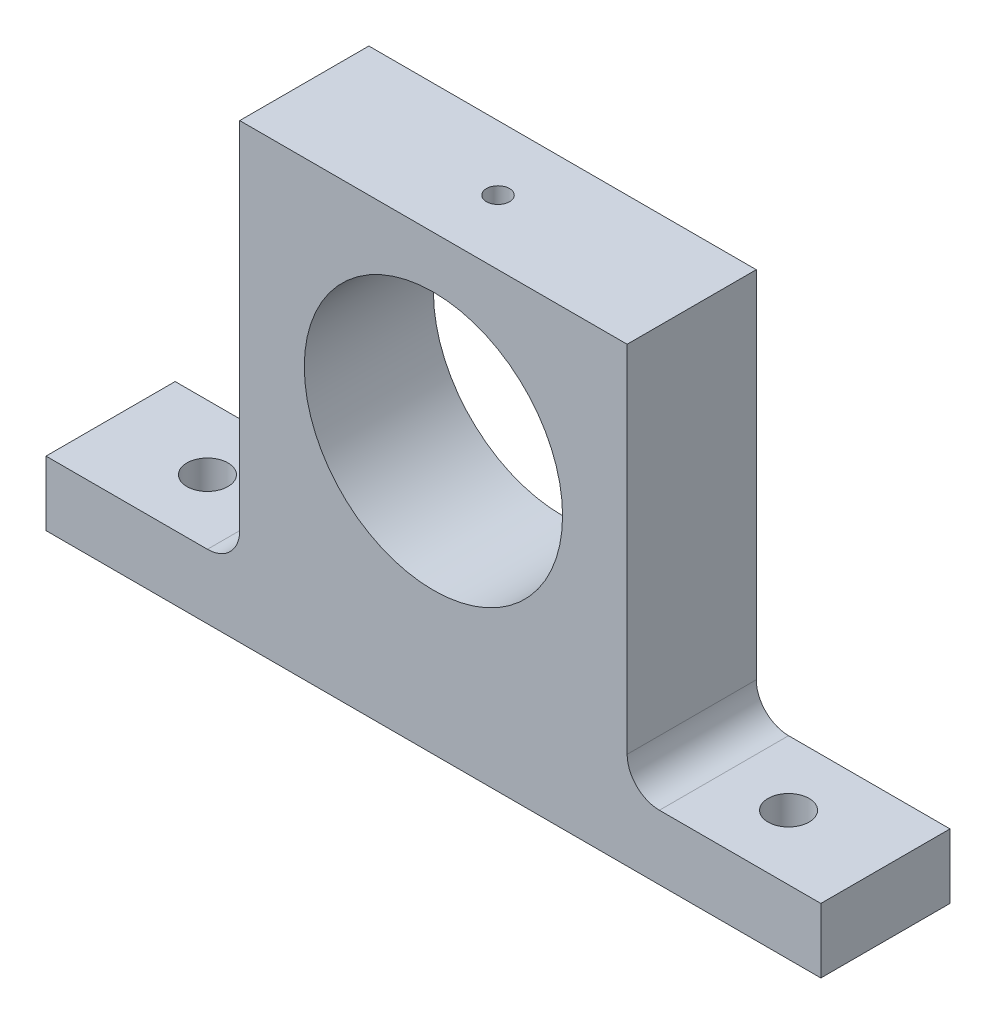
from build123d import *

# Parameters (mm, degrees)
SKETCH1_R                 = 12.7
BOSS_EXTRUDE1_DEPTH       = 12.7
F_10_32_TAPPED_HOLE1_D    = 4.0386
F_4_40_TAPPED_HOLE1_D     = 2.2606
F_4_40_TAPPED_HOLE1_DEPTH = 17.779
F_4_40_TAPPED_HOLE1_TIP   = 0.679152758
FILLET1_R                 = 3.175


with BuildPart() as part:
    # Sketch1 → Boss-Extrude1 (new body)
    with BuildSketch(Plane.XY):
        Polygon((38.1, 0), (-38.1, 0), (-38.1, 6.35), (-19.05, 6.35), (-19.05, 44.45), (19.05, 44.45), (19.05, 6.35), (38.1, 6.35), align=None)
        with Locations((0, 26.67)):
            Circle(SKETCH1_R, mode=Mode.SUBTRACT)
    extrude(amount=BOSS_EXTRUDE1_DEPTH)

    # #10-32 Tapped Hole1 (through all)
    with Locations(Plane(origin=(-28.575, 6.35, 6.35), x_dir=(1, 0, 0), z_dir=(0, 1, 0))):
        with Locations((0, 0), (57.15, 0)):
            Hole(F_10_32_TAPPED_HOLE1_D / 2)

    # #4-40 Tapped Hole1
    with Locations(Plane(origin=(0, 44.45, 0), x_dir=(-1, 0, 0), z_dir=(0, 1, 0))):
        with Locations((0, 6.35)):
            Hole(F_4_40_TAPPED_HOLE1_D / 2, depth=F_4_40_TAPPED_HOLE1_DEPTH)
            with Locations((0, 0, -(F_4_40_TAPPED_HOLE1_DEPTH + F_4_40_TAPPED_HOLE1_TIP / 2))):  # 118° drill point
                Cone(0, F_4_40_TAPPED_HOLE1_D / 2, F_4_40_TAPPED_HOLE1_TIP, mode=Mode.SUBTRACT)

    # Fillet1
    fillet1_edges = [part.edges().sort_by_distance(p)[0] for p in [
        (-19.05, 6.35, 6.35),
        (19.05, 6.35, 6.35),
    ]]
    fillet(fillet1_edges, radius=FILLET1_R)


solid = part.part
